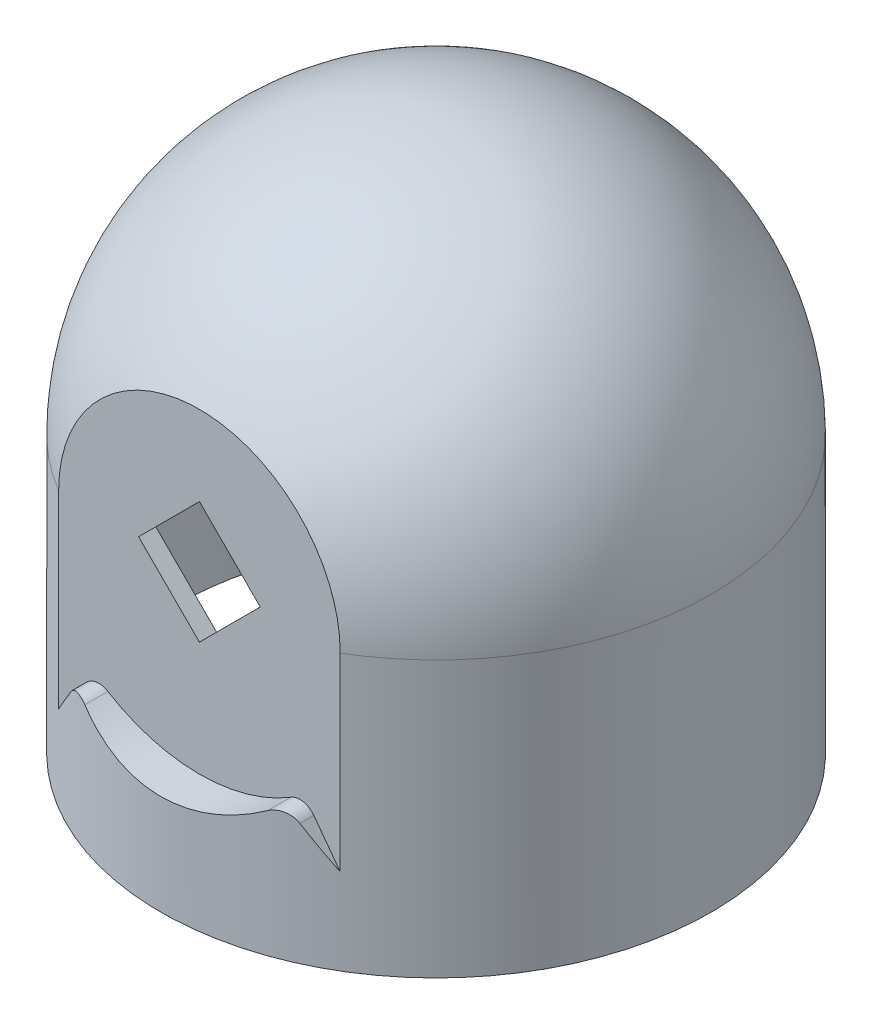
from build123d import *

# Parameters (mm, degrees)
REVOLVE1_ANGLE           = 180
CUT_EXTRUDE1_DEPTH       = 39.328351126
SHELL1_DEPTH             = 16
SHELL1_2_DEPTH           = 4
EXTRUDE1_REACH           = 40.328
EXTRUDE1_END_RADIUS      = 16
CUT_EXTRUDE2_REACH       = 40.328
EXTRUDE_THIN1_REACH      = 53.192
EXTRUDE_THIN1_END_RADIUS = 15
EXTRUDE_THIN1_START      = -12
SKETCH5_R                = 5.5
SKETCH5_R_2              = 4.5
FILLET_1_R               = 1


with BuildPart() as part:
    # Sketch1 → Revolve1 (revolve)
    with BuildSketch(Plane(origin=(0, 0, 0), x_dir=(-1, 0, 0), z_dir=(0, 0, -1))):
        with BuildLine():
            Line((0, 0), (16, 0))
            Line((16, 0), (16, 16))
            ThreePointArc((16, 16), (11.313708499, 27.313708499), (0, 32))
            Line((0, 32), (0, 0))
        make_face()
    revolve(axis=Axis((0, 0, 0), (0, 1, 0)), revolution_arc=REVOLVE1_ANGLE)

    # Sketch2 → Cut-Extrude1 (cut, through all)
    with BuildSketch(Plane.XY.offset(13.75)):
        with BuildLine():
            Line((8.181534086, 5), (8.181534086, 16))
            ThreePointArc((8.181534086, 16), (0, 24.181534086), (-8.181534086, 16))
            Line((-8.181534086, 16), (-8.181534086, 5))
            Line((-8.181534086, 5), (8.181534086, 5))
        make_face()
    extrude(amount=CUT_EXTRUDE1_DEPTH, mode=Mode.SUBTRACT)

    # Shell1: read off the stored shape, not the designer's step
    # Shell1 outline → Shell1 (cut)
    with BuildSketch(Plane(origin=(0, 0, 0), x_dir=(1, 0, 0), z_dir=(0, 1, 0))):
        with BuildLine():
            ThreePointArc((7.901740315, -12.75), (13.105840391, -7.296365372), (15, 0))
            Line((15, 0), (-15, 0))
            ThreePointArc((-15, 0), (-13.105840391, -7.296365372), (-7.901740315, -12.75))
            Line((-7.901740315, -12.75), (7.901740315, -12.75))
        make_face()
    extrude(amount=SHELL1_DEPTH, mode=Mode.SUBTRACT)

    # Shell1 2 outline → Shell1 2 (cut)
    with BuildSketch(Plane(origin=(0, 0, 0), x_dir=(1, 0, 0), z_dir=(0, 1, 0))):
        with BuildLine():
            ThreePointArc((-7.901740315, -12.75), (0, -15), (7.901740315, -12.75))
            Line((7.901740315, -12.75), (-7.901740315, -12.75))
        make_face()
    extrude(amount=SHELL1_2_DEPTH, mode=Mode.SUBTRACT)

    # Shell1 3 outline → Shell1 3 (revolve, cut)
    with BuildSketch(Plane.XZ.offset(-16)):
        with BuildLine():
            ThreePointArc((15, 0), (13.105840391, 7.296365372), (7.901740315, 12.75))
            Line((7.901740315, 12.75), (0, 12.75))
            Line((0, 12.75), (0, 0))
            Line((0, 0), (15, 0))
        make_face()
    revolve(axis=Axis((0, 16, 0), (0, 0, 1)), mode=Mode.SUBTRACT)

    # Extrude1: up to this cylinder (the profile starts inside it)
    extrude1_end = Plane(origin=(0, 6.31611, 0), z_dir=(0, -1, 0)) * Cylinder(EXTRUDE1_END_RADIUS, 113.656, mode=Mode.PRIVATE)
    # Sketch3 → Extrude1 (add, up to the surface)
    with BuildSketch(Plane.XY.offset(13.75), mode=Mode.PRIVATE) as extrude1_sk1:
        with BuildLine():
            Line((6.076328446, 7.830430308), (8.181534086, 5))
            Line((8.181534086, 5), (-8.181534086, 5))
            Line((-8.181534086, 5), (-6.076328446, 7.830430308))
            ThreePointArc((-6.076328446, 7.830430308), (0, 5.818465914), (6.076328446, 7.830430308))
        make_face()
    extrude1_tool1 = extrude(extrude1_sk1.sketch, amount=EXTRUDE1_REACH, mode=Mode.PRIVATE) & extrude1_end
    add(extrude1_tool1.solids().sort_by_distance((6.995686, 6.31611, 13.75))[0])

    # Sketch4 → Cut-Extrude2 (cut, up to next)
    with BuildSketch(Plane.XY.offset(13.75), mode=Mode.PRIVATE) as cut_extrude2_sk1:
        Polygon((-3.535533906, 16), (0, 12.464466094), (3.535533906, 16), (0, 19.535533906), align=None)
    cut_extrude2_tool1 = extrude(cut_extrude2_sk1.sketch, amount=-CUT_EXTRUDE2_REACH, mode=Mode.PRIVATE) & part.part
    add(cut_extrude2_tool1.solids().sort_by_distance((0, 16, 13.75))[0], mode=Mode.SUBTRACT)

    # Mirror1: part across face


with BuildPart() as part_1:
    add(part.part)
    add(part.part.mirror(Plane(origin=(0, 18.784156894, 0), x_dir=(1, 0, 0), z_dir=(0, 0, -1))))

    # Extrude-Thin1: up to this sphere (the profile starts inside it)
    extrude_thin1_end = Location((0, 16, 0)) * Sphere(EXTRUDE_THIN1_END_RADIUS, mode=Mode.PRIVATE)
    # Sketch5 → Extrude-Thin1 (add, up to the surface)
    with BuildSketch(Plane.XZ.offset(EXTRUDE_THIN1_START), mode=Mode.PRIVATE) as extrude_thin1_sk1:
        Circle(SKETCH5_R)
        Circle(SKETCH5_R_2, mode=Mode.SUBTRACT)
    extrude_thin1_tool1 = extrude(extrude_thin1_sk1.sketch, amount=-EXTRUDE_THIN1_REACH, mode=Mode.PRIVATE) & extrude_thin1_end
    add(extrude_thin1_tool1.solids().sort_by_distance((-5.344437, 12, 0))[0])

    # 圓角1
    fillet_1_edges = [part_1.edges().sort_by_distance(p)[0] for p in [
        (6.076328446, 7.830430308, 14.275645793),
        (-6.076328446, 7.830430308, 14.275645793),
        (-6.076328446, 7.830430308, -14.275645793),
        (6.076328446, 7.830430308, -14.275645793),
    ]]
    fillet(fillet_1_edges, radius=FILLET_1_R)


solid = part_1.part
